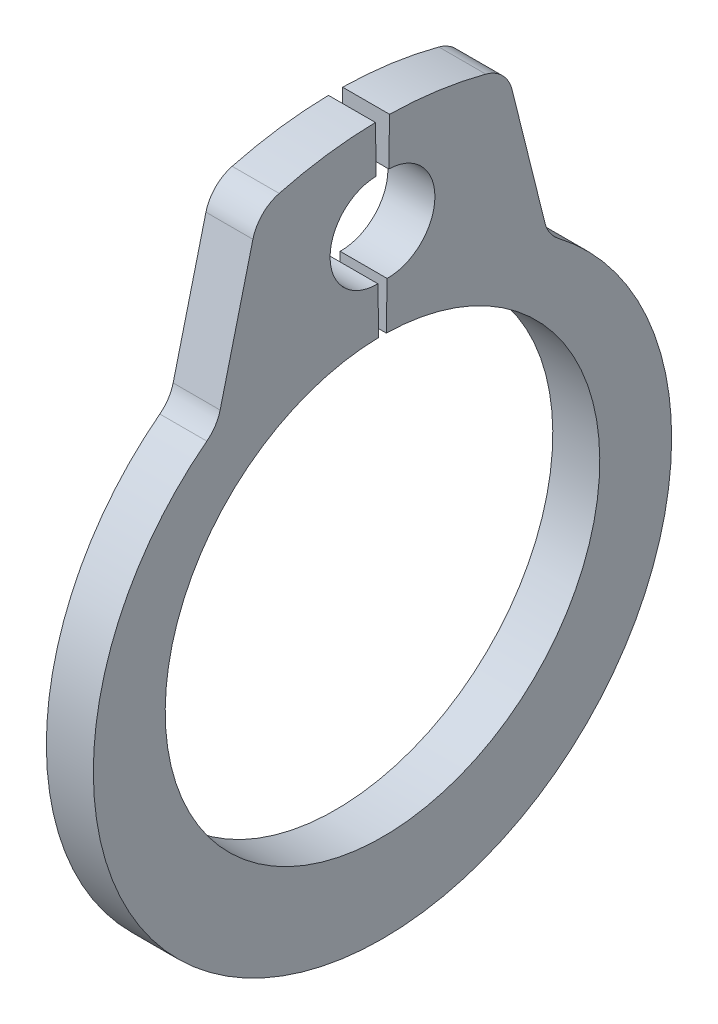
from build123d import *

# Parameters (mm, degrees)
EXTRUDE1_DEPTH = 0.4
FILLET1_R      = 0.625


with BuildPart() as part:
    # Sketch1 → Extrude1 (new, symmetric)
    with BuildSketch(Plane(origin=(0, 0, 0), x_dir=(0, 0, -1), z_dir=(1, 0, 0))):
        with BuildLine():
            Line((0.064573904, 3.699436472), (0.078535829, 4.499314628))
            ThreePointArc((0.078535829, 4.499314628), (0.89237591, 5.285230859), (0.106459679, 6.09907094))
            Line((0.106459679, 6.09907094), (0.120421604, 6.898949097))
            ThreePointArc((0.120421604, 6.898949097), (1.132430932, 6.806438142), (2.119876399, 6.56628693))
            Line((2.119876399, 6.56628693), (2.819461663, 3.760403693))
            ThreePointArc((2.819461663, 3.760403693), (0, -5.2), (-2.819461663, 3.760403693))
            Line((-2.819461663, 3.760403693), (-2.119876399, 6.56628693))
            ThreePointArc((-2.119876399, 6.56628693), (-1.132430932, 6.806438142), (-0.120421604, 6.898949097))
            Line((-0.120421604, 6.898949097), (-0.106459679, 6.09907094))
            ThreePointArc((-0.106459679, 6.09907094), (-0.89237591, 5.285230859), (-0.078535829, 4.499314628))
            Line((-0.078535829, 4.499314628), (-0.064573904, 3.699436472))
            ThreePointArc((-0.064573904, 3.699436472), (0, -3.7), (0.064573904, 3.699436472))
        make_face()
    extrude(amount=EXTRUDE1_DEPTH, both=True)

    # Fillet1
    fillet1_edges = [part.edges().sort_by_distance(p)[0] for p in [
        (0, 3.760403693, 2.819461663),
        (0, 6.56628693, 2.119876399),
        (0, 6.56628693, -2.119876399),
        (0, 3.760403693, -2.819461663),
    ]]
    fillet(fillet1_edges, radius=FILLET1_R)


solid = part.part
